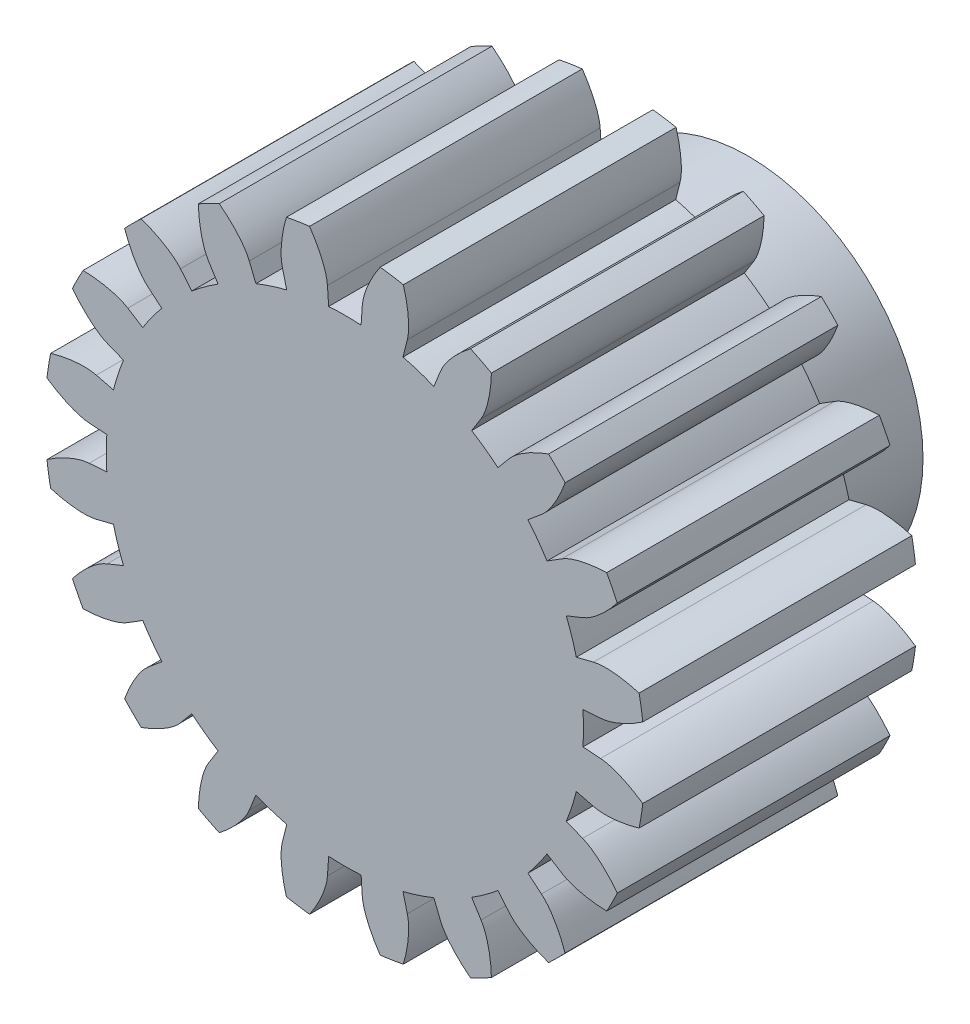
from build123d import *

# Parameters (mm, degrees)
SKETCH_1_R               = 5.5
SKETCH_1_R_2             = 1.475
EXTRUDE_1_DEPTH          = 5
CUT_EXTRUDE_1_DEPTH      = 10.246621004
PATTERN_CIRCULAR_1_DEPTH = 5
SKETCH_2_R               = 1.475
EXTRUDE_2_DEPTH          = 5
SKETCH_3_R               = 3.2
SKETCH_3_R_2             = 2.2
EXTRUDE_3_DEPTH          = 2.4
SKETCH_5_R               = 1.2
CUT_EXTRUDE_2_DEPTH      = 1


# Read off the part's stored shape, not the designer's step: 阵列(圆周)1
with BuildPart() as part:
    # 草图1 → 凸台-拉伸1 (new body)
    with BuildSketch(Plane.XY):
        Circle(SKETCH_1_R)
        Circle(SKETCH_1_R_2, mode=Mode.SUBTRACT)
    extrude(amount=EXTRUDE_1_DEPTH)

    # 草图1<3> → 切除-拉伸1 (cut, through all)
    with BuildSketch(Plane.XY):
        with BuildLine():
            Line((4.68759624, 0.319369739), (4.364881259, 0.297382905))
            ThreePointArc((4.364881259, 0.297382905), (4.372469583, 0.148777503), (4.375, 0))
            ThreePointArc((4.375, 0), (4.372469583, -0.148777503), (4.364881259, -0.297382905))
            Line((4.364881259, -0.297382905), (4.68759624, -0.319369739))
            add(Edge.make_bspline(
                [(4.68759624, -0.319369739), (4.723328518, -0.321804208), (4.822539562, -0.336024472), (5.006239619, -0.392562489), (5.199142564, -0.482491423), (5.35109765, -0.572850293), (5.444197274, -0.635344688), (5.461765036, -0.647396861)],
                knots=[0, 0, 0, 0, 0, 0.005604068, 0.015718248, 0.029959916, 0.033300536, 0.033300536, 0.033300536, 0.033300536, 0.033300536], degree=4))
            ThreePointArc((5.461765036, -0.647396861), (5.490432938, -0.324262474), (5.5, 0))
            ThreePointArc((5.5, 0), (5.490432938, 0.324262474), (5.461765036, 0.647396861))
            add(Edge.make_bspline(
                [(4.68759624, 0.319369739), (4.723328518, 0.321804208), (4.822539562, 0.336024472), (5.006239619, 0.392562489), (5.199142564, 0.482491423), (5.35109765, 0.572850293), (5.444197274, 0.635344688), (5.461765036, 0.647396861)],
                knots=[0, 0, 0, 0, 0, 0.005604068, 0.015718248, 0.029959916, 0.033300536, 0.033300536, 0.033300536, 0.033300536, 0.033300536], degree=4))
        make_face()
    extrude(amount=CUT_EXTRUDE_1_DEPTH, mode=Mode.SUBTRACT)

    # 阵列(圆周)1 outline → 阵列(圆周)1 (cut)
    with BuildSketch(Plane.XY):
        with BuildLine():
            Line((4.243145136, 1.065994538), (4.556859627, 1.14480823))
            add(Edge.make_bspline(
                [(4.556859627, 1.14480823), (4.591595335, 1.153534793), (4.690344948, 1.170668417), (4.882525293, 1.173664007), (5.093776464, 1.147746796), (5.266216765, 1.108767108), (5.374071599, 1.078100773), (5.39450386, 1.072067212)],
                knots=[0, 0, 0, 0, 0, 0.005604068, 0.015718248, 0.029959916, 0.033300536, 0.033300536, 0.033300536, 0.033300536, 0.033300536], degree=4))
            ThreePointArc((5.39450386, 1.072067212), (5.23081084, 1.699593469), (4.994390596, 2.303489219))
            add(Edge.make_bspline(
                [(4.359478273, 1.752285572), (4.392709397, 1.765642771), (4.482670403, 1.809824945), (4.639908332, 1.920362233), (4.795580365, 2.065500021), (4.912175813, 2.198393117), (4.981406987, 2.286598184), (4.994390596, 2.303489219)],
                knots=[0, 0, 0, 0, 0, 0.005604068, 0.015718248, 0.029959916, 0.033300536, 0.033300536, 0.033300536, 0.033300536, 0.033300536], degree=4))
            Line((4.359478273, 1.752285572), (4.059352393, 1.631650437))
            ThreePointArc((4.059352393, 1.631650437), (4.160872259, 1.35194935), (4.243145136, 1.065994538))
        make_face()
        with BuildLine():
            add(Edge.make_bspline(
                [(4.359478273, -1.752285572), (4.392709397, -1.765642771), (4.482670403, -1.809824945), (4.639908332, -1.920362233), (4.795580365, -2.065500021), (4.912175813, -2.198393117), (4.981406987, -2.286598184), (4.994390595, -2.303489218)],
                knots=[0, 0, 0, 0, 0, 0.005604068, 0.015718248, 0.029959916, 0.033300536, 0.033300536, 0.033300536, 0.033300536, 0.033300536], degree=4))
            ThreePointArc((4.994390595, -2.303489218), (5.23081084, -1.699593469), (5.39450386, -1.072067212))
            add(Edge.make_bspline(
                [(4.556859627, -1.14480823), (4.591595335, -1.153534793), (4.690344948, -1.170668417), (4.882525293, -1.173664007), (5.093776464, -1.147746796), (5.266216765, -1.108767108), (5.374071599, -1.078100773), (5.39450386, -1.072067212)],
                knots=[0, 0, 0, 0, 0, 0.005604068, 0.015718248, 0.029959916, 0.033300536, 0.033300536, 0.033300536, 0.033300536, 0.033300536], degree=4))
            Line((4.556859627, -1.14480823), (4.243145136, -1.065994538))
            ThreePointArc((4.243145136, -1.065994538), (4.160872259, -1.35194935), (4.059352393, -1.631650437))
            Line((4.059352393, -1.631650437), (4.359478273, -1.752285572))
        make_face()
        with BuildLine():
            add(Edge.make_bspline(
                [(3.604624198, -3.013675485), (3.632101274, -3.036647918), (3.704006232, -3.106467142), (3.819390489, -3.260183543), (3.922593347, -3.446323085), (3.992415983, -3.608741904), (4.031001877, -3.714023518), (4.038130406, -3.734100002)],
                knots=[0, 0, 0, 0, 0, 0.005604068, 0.015718248, 0.029959916, 0.033300536, 0.033300536, 0.033300536, 0.033300536, 0.033300536], degree=4))
            ThreePointArc((4.038130406, -3.734100002), (4.449593469, -3.232818888), (4.799191061, -2.686589877))
            add(Edge.make_bspline(
                [(3.980065843, -2.496924392), (4.010404809, -2.515957772), (4.099026691, -2.562768124), (4.280875372, -2.625004093), (4.489796033, -2.665635562), (4.665841891, -2.681850659), (4.777894353, -2.686014218), (4.799191061, -2.686589877)],
                knots=[0, 0, 0, 0, 0, 0.005604068, 0.015718248, 0.029959916, 0.033300536, 0.033300536, 0.033300536, 0.033300536, 0.033300536], degree=4))
            Line((3.980065843, -2.496924392), (3.706060403, -2.325025008))
            ThreePointArc((3.706060403, -2.325025008), (3.53944935, -2.571560479), (3.356465831, -2.806200656))
            Line((3.356465831, -2.806200656), (3.604624198, -3.013675485))
        make_face()
        with BuildLine():
            add(Edge.make_bspline(
                [(2.496924392, -3.980065843), (2.515957772, -4.010404809), (2.562768124, -4.099026691), (2.625004093, -4.280875372), (2.665635562, -4.489796033), (2.681850659, -4.665841891), (2.686014218, -4.777894353), (2.686589877, -4.79919106)],
                knots=[0, 0, 0, 0, 0, 0.005604068, 0.015718248, 0.029959916, 0.033300536, 0.033300536, 0.033300536, 0.033300536, 0.033300536], degree=4))
            ThreePointArc((2.686589877, -4.79919106), (3.232818888, -4.449593469), (3.734100002, -4.038130406))
            add(Edge.make_bspline(
                [(3.013675485, -3.604624198), (3.036647918, -3.632101274), (3.106467142, -3.704006232), (3.260183543, -3.819390489), (3.446323085, -3.922593347), (3.608741904, -3.992415983), (3.714023518, -4.031001877), (3.734100002, -4.038130406)],
                knots=[0, 0, 0, 0, 0, 0.005604068, 0.015718248, 0.029959916, 0.033300536, 0.033300536, 0.033300536, 0.033300536, 0.033300536], degree=4))
            Line((3.013675485, -3.604624198), (2.806200656, -3.356465831))
            ThreePointArc((2.806200656, -3.356465831), (2.571560479, -3.53944935), (2.325025008, -3.706060403))
            Line((2.325025008, -3.706060403), (2.496924392, -3.980065843))
        make_face()
        with BuildLine():
            add(Edge.make_bspline(
                [(1.14480823, -4.556859627), (1.153534793, -4.591595335), (1.170668417, -4.690344948), (1.173664007, -4.882525293), (1.147746796, -5.093776464), (1.108767108, -5.266216765), (1.078100773, -5.374071599), (1.072067212, -5.39450386)],
                knots=[0, 0, 0, 0, 0, 0.005604068, 0.015718248, 0.029959916, 0.033300536, 0.033300536, 0.033300536, 0.033300536, 0.033300536], degree=4))
            ThreePointArc((1.072067212, -5.39450386), (1.699593469, -5.23081084), (2.303489219, -4.994390596))
            add(Edge.make_bspline(
                [(1.752285572, -4.359478273), (1.765642771, -4.392709397), (1.809824945, -4.482670403), (1.920362233, -4.639908332), (2.065500021, -4.795580365), (2.198393117, -4.912175813), (2.286598184, -4.981406987), (2.303489219, -4.994390596)],
                knots=[0, 0, 0, 0, 0, 0.005604068, 0.015718248, 0.029959916, 0.033300536, 0.033300536, 0.033300536, 0.033300536, 0.033300536], degree=4))
            Line((1.752285572, -4.359478273), (1.631650437, -4.059352393))
            ThreePointArc((1.631650437, -4.059352393), (1.35194935, -4.160872259), (1.065994538, -4.243145136))
            Line((1.065994538, -4.243145136), (1.14480823, -4.556859627))
        make_face()
        with BuildLine():
            add(Edge.make_bspline(
                [(-0.319369739, -4.68759624), (-0.321804208, -4.723328518), (-0.336024472, -4.822539562), (-0.392562489, -5.006239619), (-0.482491423, -5.199142564), (-0.572850293, -5.35109765), (-0.635344688, -5.444197274), (-0.647396861, -5.461765036)],
                knots=[0, 0, 0, 0, 0, 0.005604068, 0.015718248, 0.029959916, 0.033300536, 0.033300536, 0.033300536, 0.033300536, 0.033300536], degree=4))
            ThreePointArc((-0.647396861, -5.461765036), (0, -5.5), (0.647396861, -5.461765036))
            add(Edge.make_bspline(
                [(0.319369739, -4.68759624), (0.321804208, -4.723328518), (0.336024472, -4.822539562), (0.392562489, -5.006239619), (0.482491423, -5.199142564), (0.572850293, -5.35109765), (0.635344688, -5.444197274), (0.647396861, -5.461765036)],
                knots=[0, 0, 0, 0, 0, 0.005604068, 0.015718248, 0.029959916, 0.033300536, 0.033300536, 0.033300536, 0.033300536, 0.033300536], degree=4))
            Line((0.319369739, -4.68759624), (0.297382905, -4.364881259))
            ThreePointArc((0.297382905, -4.364881259), (0, -4.375), (-0.297382905, -4.364881259))
            Line((-0.297382905, -4.364881259), (-0.319369739, -4.68759624))
        make_face()
        with BuildLine():
            add(Edge.make_bspline(
                [(-1.752285572, -4.359478273), (-1.765642771, -4.392709397), (-1.809824945, -4.482670403), (-1.920362233, -4.639908332), (-2.065500021, -4.795580365), (-2.198393117, -4.912175813), (-2.286598184, -4.981406987), (-2.303489218, -4.994390595)],
                knots=[0, 0, 0, 0, 0, 0.005604068, 0.015718248, 0.029959916, 0.033300536, 0.033300536, 0.033300536, 0.033300536, 0.033300536], degree=4))
            ThreePointArc((-2.303489218, -4.994390595), (-1.699593469, -5.23081084), (-1.072067212, -5.39450386))
            add(Edge.make_bspline(
                [(-1.14480823, -4.556859627), (-1.153534793, -4.591595335), (-1.170668417, -4.690344948), (-1.173664007, -4.882525293), (-1.147746796, -5.093776464), (-1.108767108, -5.266216765), (-1.078100773, -5.374071599), (-1.072067212, -5.39450386)],
                knots=[0, 0, 0, 0, 0, 0.005604068, 0.015718248, 0.029959916, 0.033300536, 0.033300536, 0.033300536, 0.033300536, 0.033300536], degree=4))
            Line((-1.14480823, -4.556859627), (-1.065994538, -4.243145136))
            ThreePointArc((-1.065994538, -4.243145136), (-1.35194935, -4.160872259), (-1.631650437, -4.059352393))
            Line((-1.631650437, -4.059352393), (-1.752285572, -4.359478273))
        make_face()
        with BuildLine():
            add(Edge.make_bspline(
                [(-3.013675485, -3.604624198), (-3.036647918, -3.632101274), (-3.106467142, -3.704006232), (-3.260183543, -3.819390489), (-3.446323085, -3.922593347), (-3.608741904, -3.992415983), (-3.714023518, -4.031001877), (-3.734100002, -4.038130406)],
                knots=[0, 0, 0, 0, 0, 0.005604068, 0.015718248, 0.029959916, 0.033300536, 0.033300536, 0.033300536, 0.033300536, 0.033300536], degree=4))
            ThreePointArc((-3.734100002, -4.038130406), (-3.232818888, -4.449593469), (-2.686589877, -4.79919106))
            add(Edge.make_bspline(
                [(-2.496924392, -3.980065843), (-2.515957772, -4.010404809), (-2.562768124, -4.099026691), (-2.625004093, -4.280875372), (-2.665635562, -4.489796033), (-2.681850659, -4.665841891), (-2.686014218, -4.777894353), (-2.686589877, -4.79919106)],
                knots=[0, 0, 0, 0, 0, 0.005604068, 0.015718248, 0.029959916, 0.033300536, 0.033300536, 0.033300536, 0.033300536, 0.033300536], degree=4))
            Line((-2.496924392, -3.980065843), (-2.325025008, -3.706060403))
            ThreePointArc((-2.325025008, -3.706060403), (-2.571560479, -3.53944935), (-2.806200656, -3.356465831))
            Line((-2.806200656, -3.356465831), (-3.013675485, -3.604624198))
        make_face()
        with BuildLine():
            add(Edge.make_bspline(
                [(-3.980065843, -2.496924392), (-4.010404809, -2.515957772), (-4.099026691, -2.562768124), (-4.280875372, -2.625004093), (-4.489796033, -2.665635562), (-4.665841891, -2.681850659), (-4.777894353, -2.686014218), (-4.79919106, -2.686589877)],
                knots=[0, 0, 0, 0, 0, 0.005604068, 0.015718248, 0.029959916, 0.033300536, 0.033300536, 0.033300536, 0.033300536, 0.033300536], degree=4))
            ThreePointArc((-4.79919106, -2.686589877), (-4.449593469, -3.232818888), (-4.038130406, -3.734100002))
            add(Edge.make_bspline(
                [(-3.604624198, -3.013675485), (-3.632101274, -3.036647918), (-3.704006232, -3.106467142), (-3.819390489, -3.260183543), (-3.922593347, -3.446323085), (-3.992415983, -3.608741904), (-4.031001877, -3.714023518), (-4.038130406, -3.734100002)],
                knots=[0, 0, 0, 0, 0, 0.005604068, 0.015718248, 0.029959916, 0.033300536, 0.033300536, 0.033300536, 0.033300536, 0.033300536], degree=4))
            Line((-3.604624198, -3.013675485), (-3.356465831, -2.806200656))
            ThreePointArc((-3.356465831, -2.806200656), (-3.53944935, -2.571560479), (-3.706060403, -2.325025008))
            Line((-3.706060403, -2.325025008), (-3.980065843, -2.496924392))
        make_face()
        with BuildLine():
            add(Edge.make_bspline(
                [(-4.556859627, -1.14480823), (-4.591595335, -1.153534793), (-4.690344948, -1.170668417), (-4.882525293, -1.173664007), (-5.093776464, -1.147746796), (-5.266216765, -1.108767108), (-5.374071599, -1.078100773), (-5.39450386, -1.072067212)],
                knots=[0, 0, 0, 0, 0, 0.005604068, 0.015718248, 0.029959916, 0.033300536, 0.033300536, 0.033300536, 0.033300536, 0.033300536], degree=4))
            ThreePointArc((-5.39450386, -1.072067212), (-5.23081084, -1.699593469), (-4.994390596, -2.303489218))
            add(Edge.make_bspline(
                [(-4.359478273, -1.752285572), (-4.392709397, -1.765642771), (-4.482670403, -1.809824945), (-4.639908332, -1.920362233), (-4.795580365, -2.065500021), (-4.912175813, -2.198393117), (-4.981406987, -2.286598184), (-4.994390596, -2.303489218)],
                knots=[0, 0, 0, 0, 0, 0.005604068, 0.015718248, 0.029959916, 0.033300536, 0.033300536, 0.033300536, 0.033300536, 0.033300536], degree=4))
            Line((-4.359478273, -1.752285572), (-4.059352393, -1.631650437))
            ThreePointArc((-4.059352393, -1.631650437), (-4.160872259, -1.35194935), (-4.243145136, -1.065994538))
            Line((-4.243145136, -1.065994538), (-4.556859627, -1.14480823))
        make_face()
        with BuildLine():
            add(Edge.make_bspline(
                [(-4.68759624, 0.319369739), (-4.723328518, 0.321804208), (-4.822539562, 0.336024472), (-5.006239619, 0.392562489), (-5.199142564, 0.482491423), (-5.35109765, 0.572850293), (-5.444197274, 0.635344688), (-5.461765036, 0.647396861)],
                knots=[0, 0, 0, 0, 0, 0.005604068, 0.015718248, 0.029959916, 0.033300536, 0.033300536, 0.033300536, 0.033300536, 0.033300536], degree=4))
            ThreePointArc((-5.461765036, 0.647396861), (-5.5, 0), (-5.461765036, -0.647396861))
            add(Edge.make_bspline(
                [(-4.68759624, -0.319369739), (-4.723328518, -0.321804208), (-4.822539562, -0.336024472), (-5.006239619, -0.392562489), (-5.199142564, -0.482491423), (-5.35109765, -0.572850293), (-5.444197274, -0.635344688), (-5.461765036, -0.647396861)],
                knots=[0, 0, 0, 0, 0, 0.005604068, 0.015718248, 0.029959916, 0.033300536, 0.033300536, 0.033300536, 0.033300536, 0.033300536], degree=4))
            Line((-4.68759624, -0.319369739), (-4.364881259, -0.297382905))
            ThreePointArc((-4.364881259, -0.297382905), (-4.375, 0), (-4.364881259, 0.297382905))
            Line((-4.364881259, 0.297382905), (-4.68759624, 0.319369739))
        make_face()
        with BuildLine():
            add(Edge.make_bspline(
                [(-4.359478273, 1.752285572), (-4.392709397, 1.765642771), (-4.482670403, 1.809824945), (-4.639908332, 1.920362233), (-4.795580365, 2.065500021), (-4.912175813, 2.198393117), (-4.981406987, 2.286598184), (-4.994390595, 2.303489218)],
                knots=[0, 0, 0, 0, 0, 0.005604068, 0.015718248, 0.029959916, 0.033300536, 0.033300536, 0.033300536, 0.033300536, 0.033300536], degree=4))
            ThreePointArc((-4.994390595, 2.303489218), (-5.23081084, 1.699593469), (-5.39450386, 1.072067212))
            add(Edge.make_bspline(
                [(-4.556859627, 1.14480823), (-4.591595335, 1.153534793), (-4.690344948, 1.170668417), (-4.882525293, 1.173664007), (-5.093776464, 1.147746796), (-5.266216765, 1.108767108), (-5.374071599, 1.078100773), (-5.39450386, 1.072067212)],
                knots=[0, 0, 0, 0, 0, 0.005604068, 0.015718248, 0.029959916, 0.033300536, 0.033300536, 0.033300536, 0.033300536, 0.033300536], degree=4))
            Line((-4.556859627, 1.14480823), (-4.243145136, 1.065994538))
            ThreePointArc((-4.243145136, 1.065994538), (-4.160872259, 1.35194935), (-4.059352393, 1.631650437))
            Line((-4.059352393, 1.631650437), (-4.359478273, 1.752285572))
        make_face()
        with BuildLine():
            add(Edge.make_bspline(
                [(-3.604624198, 3.013675485), (-3.632101274, 3.036647918), (-3.704006232, 3.106467142), (-3.819390489, 3.260183543), (-3.922593347, 3.446323085), (-3.992415983, 3.608741904), (-4.031001877, 3.714023518), (-4.038130406, 3.734100002)],
                knots=[0, 0, 0, 0, 0, 0.005604068, 0.015718248, 0.029959916, 0.033300536, 0.033300536, 0.033300536, 0.033300536, 0.033300536], degree=4))
            ThreePointArc((-4.038130406, 3.734100002), (-4.449593469, 3.232818888), (-4.79919106, 2.686589877))
            add(Edge.make_bspline(
                [(-3.980065843, 2.496924392), (-4.010404809, 2.515957772), (-4.099026691, 2.562768124), (-4.280875372, 2.625004093), (-4.489796033, 2.665635562), (-4.665841891, 2.681850659), (-4.777894353, 2.686014218), (-4.79919106, 2.686589877)],
                knots=[0, 0, 0, 0, 0, 0.005604068, 0.015718248, 0.029959916, 0.033300536, 0.033300536, 0.033300536, 0.033300536, 0.033300536], degree=4))
            Line((-3.980065843, 2.496924392), (-3.706060403, 2.325025008))
            ThreePointArc((-3.706060403, 2.325025008), (-3.53944935, 2.571560479), (-3.356465831, 2.806200656))
            Line((-3.356465831, 2.806200656), (-3.604624198, 3.013675485))
        make_face()
        with BuildLine():
            add(Edge.make_bspline(
                [(-2.496924392, 3.980065843), (-2.515957772, 4.010404809), (-2.562768124, 4.099026691), (-2.625004093, 4.280875372), (-2.665635562, 4.489796033), (-2.681850659, 4.665841891), (-2.686014218, 4.777894353), (-2.686589877, 4.79919106)],
                knots=[0, 0, 0, 0, 0, 0.005604068, 0.015718248, 0.029959916, 0.033300536, 0.033300536, 0.033300536, 0.033300536, 0.033300536], degree=4))
            ThreePointArc((-2.686589877, 4.79919106), (-3.232818888, 4.449593469), (-3.734100002, 4.038130406))
            add(Edge.make_bspline(
                [(-3.013675485, 3.604624198), (-3.036647918, 3.632101274), (-3.106467142, 3.704006232), (-3.260183543, 3.819390489), (-3.446323085, 3.922593347), (-3.608741904, 3.992415983), (-3.714023518, 4.031001877), (-3.734100002, 4.038130406)],
                knots=[0, 0, 0, 0, 0, 0.005604068, 0.015718248, 0.029959916, 0.033300536, 0.033300536, 0.033300536, 0.033300536, 0.033300536], degree=4))
            Line((-3.013675485, 3.604624198), (-2.806200656, 3.356465831))
            ThreePointArc((-2.806200656, 3.356465831), (-2.571560479, 3.53944935), (-2.325025008, 3.706060403))
            Line((-2.325025008, 3.706060403), (-2.496924392, 3.980065843))
        make_face()
        with BuildLine():
            add(Edge.make_bspline(
                [(-1.14480823, 4.556859627), (-1.153534793, 4.591595335), (-1.170668417, 4.690344948), (-1.173664007, 4.882525293), (-1.147746796, 5.093776464), (-1.108767108, 5.266216765), (-1.078100773, 5.374071599), (-1.072067212, 5.39450386)],
                knots=[0, 0, 0, 0, 0, 0.005604068, 0.015718248, 0.029959916, 0.033300536, 0.033300536, 0.033300536, 0.033300536, 0.033300536], degree=4))
            ThreePointArc((-1.072067212, 5.39450386), (-1.699593469, 5.23081084), (-2.303489219, 4.994390596))
            add(Edge.make_bspline(
                [(-1.752285572, 4.359478273), (-1.765642771, 4.392709397), (-1.809824945, 4.482670403), (-1.920362233, 4.639908332), (-2.065500021, 4.795580365), (-2.198393117, 4.912175813), (-2.286598184, 4.981406987), (-2.303489219, 4.994390596)],
                knots=[0, 0, 0, 0, 0, 0.005604068, 0.015718248, 0.029959916, 0.033300536, 0.033300536, 0.033300536, 0.033300536, 0.033300536], degree=4))
            Line((-1.752285572, 4.359478273), (-1.631650437, 4.059352393))
            ThreePointArc((-1.631650437, 4.059352393), (-1.35194935, 4.160872259), (-1.065994538, 4.243145136))
            Line((-1.065994538, 4.243145136), (-1.14480823, 4.556859627))
        make_face()
        with BuildLine():
            add(Edge.make_bspline(
                [(0.319369739, 4.68759624), (0.321804208, 4.723328518), (0.336024472, 4.822539562), (0.392562489, 5.006239619), (0.482491423, 5.199142564), (0.572850293, 5.35109765), (0.635344688, 5.444197274), (0.647396861, 5.461765036)],
                knots=[0, 0, 0, 0, 0, 0.005604068, 0.015718248, 0.029959916, 0.033300536, 0.033300536, 0.033300536, 0.033300536, 0.033300536], degree=4))
            ThreePointArc((0.647396861, 5.461765036), (0, 5.5), (-0.647396861, 5.461765036))
            add(Edge.make_bspline(
                [(-0.319369739, 4.68759624), (-0.321804208, 4.723328518), (-0.336024472, 4.822539562), (-0.392562489, 5.006239619), (-0.482491423, 5.199142564), (-0.572850293, 5.35109765), (-0.635344688, 5.444197274), (-0.647396861, 5.461765036)],
                knots=[0, 0, 0, 0, 0, 0.005604068, 0.015718248, 0.029959916, 0.033300536, 0.033300536, 0.033300536, 0.033300536, 0.033300536], degree=4))
            Line((-0.319369739, 4.68759624), (-0.297382905, 4.364881259))
            ThreePointArc((-0.297382905, 4.364881259), (0, 4.375), (0.297382905, 4.364881259))
            Line((0.297382905, 4.364881259), (0.319369739, 4.68759624))
        make_face()
        with BuildLine():
            add(Edge.make_bspline(
                [(1.752285572, 4.359478273), (1.765642771, 4.392709397), (1.809824945, 4.482670403), (1.920362233, 4.639908332), (2.065500021, 4.795580365), (2.198393117, 4.912175813), (2.286598184, 4.981406987), (2.303489218, 4.994390595)],
                knots=[0, 0, 0, 0, 0, 0.005604068, 0.015718248, 0.029959916, 0.033300536, 0.033300536, 0.033300536, 0.033300536, 0.033300536], degree=4))
            ThreePointArc((2.303489218, 4.994390595), (1.699593469, 5.23081084), (1.072067212, 5.39450386))
            add(Edge.make_bspline(
                [(1.14480823, 4.556859627), (1.153534793, 4.591595335), (1.170668417, 4.690344948), (1.173664007, 4.882525293), (1.147746796, 5.093776464), (1.108767108, 5.266216765), (1.078100773, 5.374071599), (1.072067212, 5.39450386)],
                knots=[0, 0, 0, 0, 0, 0.005604068, 0.015718248, 0.029959916, 0.033300536, 0.033300536, 0.033300536, 0.033300536, 0.033300536], degree=4))
            Line((1.14480823, 4.556859627), (1.065994538, 4.243145136))
            ThreePointArc((1.065994538, 4.243145136), (1.35194935, 4.160872259), (1.631650437, 4.059352393))
            Line((1.631650437, 4.059352393), (1.752285572, 4.359478273))
        make_face()
        with BuildLine():
            add(Edge.make_bspline(
                [(3.013675485, 3.604624198), (3.036647918, 3.632101274), (3.106467142, 3.704006232), (3.260183543, 3.819390489), (3.446323085, 3.922593347), (3.608741904, 3.992415983), (3.714023518, 4.031001877), (3.734100002, 4.038130406)],
                knots=[0, 0, 0, 0, 0, 0.005604068, 0.015718248, 0.029959916, 0.033300536, 0.033300536, 0.033300536, 0.033300536, 0.033300536], degree=4))
            ThreePointArc((3.734100002, 4.038130406), (3.232818888, 4.449593469), (2.686589877, 4.799191061))
            add(Edge.make_bspline(
                [(2.496924392, 3.980065843), (2.515957772, 4.010404809), (2.562768124, 4.099026691), (2.625004093, 4.280875372), (2.665635562, 4.489796033), (2.681850659, 4.665841891), (2.686014218, 4.777894353), (2.686589877, 4.799191061)],
                knots=[0, 0, 0, 0, 0, 0.005604068, 0.015718248, 0.029959916, 0.033300536, 0.033300536, 0.033300536, 0.033300536, 0.033300536], degree=4))
            Line((2.496924392, 3.980065843), (2.325025008, 3.706060403))
            ThreePointArc((2.325025008, 3.706060403), (2.571560479, 3.53944935), (2.806200656, 3.356465831))
            Line((2.806200656, 3.356465831), (3.013675485, 3.604624198))
        make_face()
        with BuildLine():
            add(Edge.make_bspline(
                [(3.980065843, 2.496924392), (4.010404809, 2.515957772), (4.099026691, 2.562768124), (4.280875372, 2.625004093), (4.489796033, 2.665635562), (4.665841891, 2.681850659), (4.777894353, 2.686014218), (4.79919106, 2.686589877)],
                knots=[0, 0, 0, 0, 0, 0.005604068, 0.015718248, 0.029959916, 0.033300536, 0.033300536, 0.033300536, 0.033300536, 0.033300536], degree=4))
            ThreePointArc((4.79919106, 2.686589877), (4.449593469, 3.232818888), (4.038130406, 3.734100002))
            add(Edge.make_bspline(
                [(3.604624198, 3.013675485), (3.632101274, 3.036647918), (3.704006232, 3.106467142), (3.819390489, 3.260183543), (3.922593347, 3.446323085), (3.992415983, 3.608741904), (4.031001877, 3.714023518), (4.038130406, 3.734100002)],
                knots=[0, 0, 0, 0, 0, 0.005604068, 0.015718248, 0.029959916, 0.033300536, 0.033300536, 0.033300536, 0.033300536, 0.033300536], degree=4))
            Line((3.604624198, 3.013675485), (3.356465831, 2.806200656))
            ThreePointArc((3.356465831, 2.806200656), (3.53944935, 2.571560479), (3.706060403, 2.325025008))
            Line((3.706060403, 2.325025008), (3.980065843, 2.496924392))
        make_face()
    extrude(amount=PATTERN_CIRCULAR_1_DEPTH, mode=Mode.SUBTRACT)

    # 草图2 → 凸台-拉伸2 (add, through all)
    with BuildSketch(Plane.XY.offset(5)):
        Circle(SKETCH_2_R)
    extrude(amount=-EXTRUDE_2_DEPTH)

    # 草图3 → 凸台-拉伸3 (add)
    # profile 1 of 2: a face of its own
    with BuildSketch(Plane(origin=(0, 0, 0), x_dir=(-1, 0, 0), z_dir=(0, 0, -1))):
        with Locations(Location((0, 0, 0), (0, 0, 180))):
            Circle(SKETCH_3_R)
        Circle(SKETCH_3_R_2, mode=Mode.SUBTRACT)
    # profile 2 of 2: a face of its own
    with BuildSketch(Plane(origin=(0, 0, 0), x_dir=(-1, 0, 0), z_dir=(0, 0, -1))):
        Polygon((0.6, -1.039230485), (1.2, 0), (0.6, 1.039230485), (-0.6, 1.039230485), (-1.2, 0), (-0.6, -1.039230485), align=None)
    extrude(amount=EXTRUDE_3_DEPTH)

    # 草图5 → 切除-拉伸2 (cut)
    with BuildSketch(Plane(origin=(0, 0, -2.4), x_dir=(-1, 0, 0), z_dir=(0, 0, -1))):
        Circle(SKETCH_5_R)
    extrude(amount=-CUT_EXTRUDE_2_DEPTH, mode=Mode.SUBTRACT)


solid = part.part
